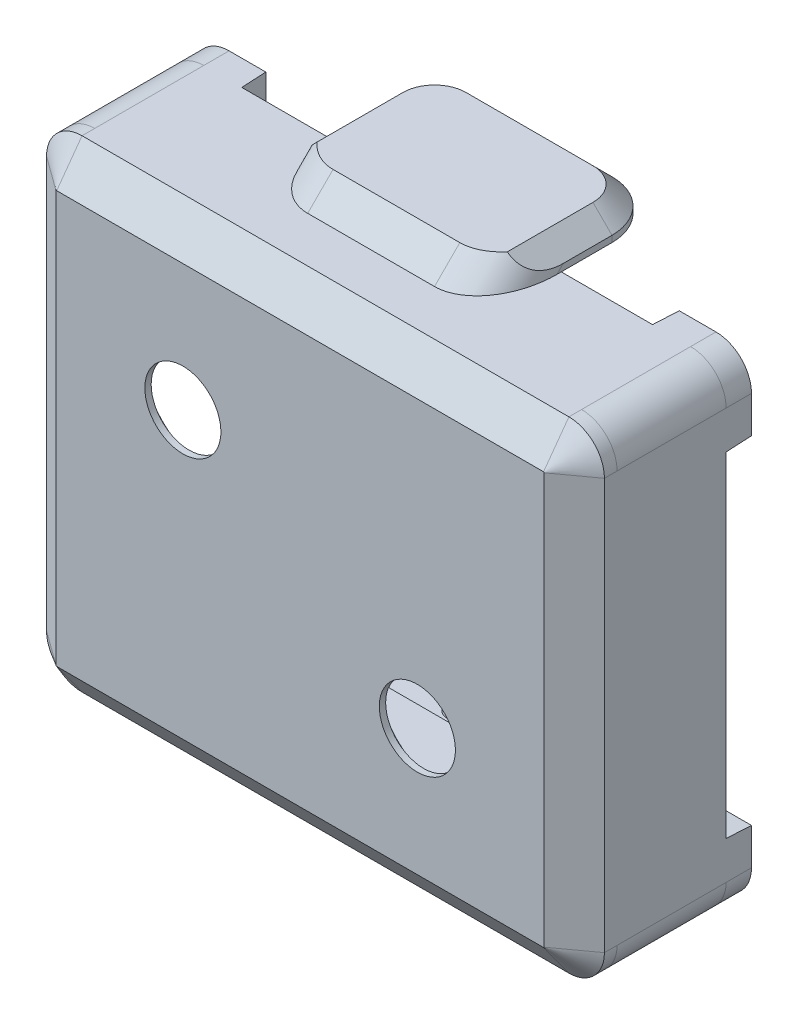
from build123d import *
from OCP.BRepAlgoAPI import BRepAlgoAPI_Cut
from OCP.TopTools import TopTools_ListOfShape
from OCP.BRepFilletAPI import BRepFilletAPI_MakeChamfer
from build123d.topology import SkipClean

# Parameters (mm, degrees)
WALLS_START            = -0.5
WALLS_DEPTH            = 4.299197948
BOTTOM_START           = 3.799199
BOTTOM_DEPTH           = 1.5
TABS_START             = 1
TABS_DEPTH             = 1
DRAFT_TABS_ANGLE       = 3
USB_HOLE_DEPTH         = 1.4
DRAFT1_ANGLE           = 3
DESQUISH_CHAMFER_SIZE  = 1
DESQUISH_CHAMFER_SIZE2 = 1.37638192
SUPPORTS_DEPTH         = 3.799198
SKETCH7_W              = 9
SKETCH7_H              = 7
BOSS_EXTRUDE1_DEPTH    = 1
BOSS_EXTRUDE2_START    = -19
SKETCH7_3_W            = 9
SKETCH7_3_H            = 7
BOSS_EXTRUDE2_DEPTH    = 1
BOSS_EXTRUDE3_DEPTH    = 0.5
BOSS_EXTRUDE4_START    = -18.5
BOSS_EXTRUDE4_DEPTH    = 0.5
FILLET2_R              = 2
FILLET1_R              = 0.5
CHAMFER1_SIZE          = 0.75
CHAMFER2_SIZE          = 1
FILLET3_R              = 2
SKETCH10_R             = 1.5
CUT_EXTRUDE1_DEPTH     = 1.5
CHAMFER3_SIZE          = 1.75
CHAMFER3_SIZE2         = 1.25


with BuildPart() as part:
    # walls: read off the stored shape, not the designer's step
    # walls outline → walls (new body)
    with BuildSketch(Plane.XY.offset(WALLS_START)):
        with BuildLine():
            ThreePointArc((20.5, 16.099999812), (20.089949494, 17.089949306), (19.1, 17.499999812))
            Line((19.1, 17.499999812), (-0.1, 17.499999812))
            ThreePointArc((-0.1, 17.499999812), (-1.089949494, 17.089949306), (-1.5, 16.099999812))
            Line((-1.5, 16.099999812), (-1.5, -0.100000188))
            ThreePointArc((-1.5, -0.100000188), (-1.089949494, -1.089949682), (-0.1, -1.500000188))
            Line((-0.1, -1.500000188), (19.1, -1.500000188))
            ThreePointArc((19.1, -1.500000188), (20.089949494, -1.089949682), (20.5, -0.100000188))
            Line((20.5, -0.100000188), (20.5, 16.099999812))
        make_face()
        Polygon((19.1, -0.100000019), (-0.1, -0.100000019), (-0.1, 16.1), (19.1, 16.099999981), align=None, mode=Mode.SUBTRACT)
    extrude(amount=WALLS_DEPTH)


with BuildPart() as bottom_tool:
    # Sketch1<6> → bottom (new body)
    with BuildSketch(Plane.XY.offset(BOTTOM_START)):
        with BuildLine():
            Line((-0.1, 17.5), (19.1, 17.5))
            ThreePointArc((19.1, 17.5), (20.089949494, 17.089949494), (20.5, 16.1))
            Line((20.5, 16.1), (20.5, -0.1))
            ThreePointArc((20.5, -0.1), (20.089949494, -1.089949494), (19.1, -1.5))
            Line((19.1, -1.5), (-0.1, -1.5))
            ThreePointArc((-0.1, -1.5), (-1.089949494, -1.089949494), (-1.5, -0.1))
            Line((-1.5, -0.1), (-1.5, 16.1))
            ThreePointArc((-1.5, 16.1), (-1.089949494, 17.089949494), (-0.1, 17.5))
        make_face()
    extrude(amount=BOTTOM_DEPTH)


with BuildPart() as part_1:
    add(part.part)


with BuildPart() as part_2:
    # bottom: joined with bottom_tool
    add(part_1.part.fuse(bottom_tool.part, tol=0.00001))

    # Sketch5 → tabs (add)
    with SkipClean():  # the faces are left unmerged after this step: merging them gives an invalid solid
        with BuildSketch(Plane(origin=(0, 0, -0.5), x_dir=(-1, 0, 0), z_dir=(0, 0, -1)).offset(TABS_START)):
            with BuildLine():
                ThreePointArc((-20.5, -0.1), (-20.089949494, -1.089949494), (-19.1, -1.5))
                Line((-19.1, -1.5), (-17.6, -1.5))
                Line((-17.6, -1.5), (-17.6, -0.1))
                Line((-17.6, -0.1), (-19.1, -0.1))
                Line((-19.1, -0.1), (-19.1, 1.4))
                Line((-19.1, 1.4), (-20.5, 1.4))
                Line((-20.5, 1.4), (-20.5, -0.1))
            make_face()
            with BuildLine():
                Line((0.1, -0.1), (-1.4, -0.1))
                Line((-1.4, -0.1), (-1.4, -1.5))
                Line((-1.4, -1.5), (0.1, -1.5))
                ThreePointArc((0.1, -1.5), (1.089949494, -1.089949494), (1.5, -0.1))
                Line((1.5, -0.1), (1.5, 1.4))
                Line((1.5, 1.4), (0.1, 1.4))
                Line((0.1, 1.4), (0.1, -0.1))
            make_face()
            with BuildLine():
                Line((-20.5, 14.6), (-19.1, 14.6))
                Line((-19.1, 14.6), (-19.1, 16.1))
                Line((-19.1, 16.1), (-17.6, 16.1))
                Line((-17.6, 16.1), (-17.6, 17.5))
                Line((-17.6, 17.5), (-19.1, 17.5))
                ThreePointArc((-19.1, 17.5), (-20.089949494, 17.089949494), (-20.5, 16.1))
                Line((-20.5, 16.1), (-20.5, 14.6))
            make_face()
            with BuildLine():
                Line((0.1, 16.1), (0.1, 14.6))
                Line((0.1, 14.6), (1.5, 14.6))
                Line((1.5, 14.6), (1.5, 16.1))
                ThreePointArc((1.5, 16.1), (1.089949494, 17.089949494), (0.1, 17.5))
                Line((0.1, 17.5), (-1.4, 17.5))
                Line((-1.4, 17.5), (-1.4, 16.1))
                Line((-1.4, 16.1), (0.1, 16.1))
            make_face()
        extrude(amount=-TABS_DEPTH)

    # draft tabs
    draft_tabs_faces = [part_2.faces().sort_by_distance(p)[0] for p in [
        (1.4, 16.8, -1),
        (19.8, 1.4, -1),
        (19.8, 14.6, -1),
        (1.4, -0.8, -1),
        (17.6, -0.8, -1),
        (17.6, 16.8, -1),
        (-0.8, 1.4, -1),
        (-0.8, 14.6, -1),
    ]]
    draft(draft_tabs_faces, Plane(origin=(0, 0, -0.5), x_dir=(-1, 0, 0), z_dir=(0, 0, -1)), DRAFT_TABS_ANGLE)

    # Sketch6 → usb hole (cut)
    with SkipClean():  # the faces are left unmerged after this step: merging them gives an invalid solid
        with BuildSketch(Plane.ZY.offset(1.5)):
            with BuildLine():
                Line((1.153553391, 1.43343172), (1.9, 1.43343172))
                ThreePointArc((1.9, 1.43343172), (2.359619408, 1.623812312), (2.55, 2.08343172))
                Line((2.55, 2.08343172), (2.55, 8.48343172))
                ThreePointArc((2.55, 8.48343172), (2.359619408, 8.943051128), (1.9, 9.13343172))
                Line((1.9, 9.13343172), (1.153553391, 9.13343172))
                ThreePointArc((1.153553391, 9.13343172), (0.90480916, 9.083953416), (0.693933983, 8.943051128))
                Line((0.693933983, 8.943051128), (0.090380592, 8.339497737))
                ThreePointArc((0.090380592, 8.339497737), (-0.050521696, 8.12862256), (-0.1, 7.879878329))
                Line((-0.1, 7.879878329), (-0.1, 5.29343172))
                Line((-0.1, 5.29343172), (-0.1, 5.27343172))
                Line((-0.1, 5.27343172), (-0.1, 2.686985111))
                ThreePointArc((-0.1, 2.686985111), (-0.050521696, 2.43824088), (0.090380592, 2.227365703))
                Line((0.090380592, 2.227365703), (0.693933983, 1.623812312))
                ThreePointArc((0.693933983, 1.623812312), (0.90480916, 1.482910024), (1.153553391, 1.43343172))
            make_face()
            with BuildLine():
                Line((-0.5, 2.227365703), (0.090380592, 2.227365703))
                ThreePointArc((0.090380592, 2.227365703), (-0.050521696, 2.43824088), (-0.1, 2.686985111))
                Line((-0.1, 2.686985111), (-0.1, 5.27343172))
                Line((-0.1, 5.27343172), (-0.1, 5.29343172))
                Line((-0.1, 5.29343172), (-0.1, 7.879878329))
                ThreePointArc((-0.1, 7.879878329), (-0.050521696, 8.12862256), (0.090380592, 8.339497737))
                Line((0.090380592, 8.339497737), (-0.5, 8.339497737))
                Line((-0.5, 8.339497737), (-0.5, 2.227365703))
            make_face()
        extrude(amount=-USB_HOLE_DEPTH, mode=Mode.SUBTRACT)

    # Draft1
    draft1_faces = [part_2.faces().sort_by_distance(p)[0] for p in [
        (-0.8, 8.339497737, -0.204809704),
        (-0.8, 2.227365703, -0.204809704),
    ]]
    draft(draft1_faces, Plane(origin=(0, 0, 0.090380592), x_dir=(0, -1, 0), z_dir=(0, 0, -1)), DRAFT1_ANGLE)

    # desquish chamfer: one chamfer whose edges measure the first distance from different faces: ONE call of the kernel's chamfer builder (chamfer() names one face for all edges)
    desquish_chamfer_edges_1 = [part_2.edges().sort_by_distance(p)[0] for p in [
        (-1.5, 8, 5.299199),
    ]]
    desquish_chamfer_side_1 = [part_2.faces().sort_by_distance(p)[0] for p in [
        (-1.5, 8.817703762, 2.795318179),
    ]]
    desquish_chamfer_edges_2 = [part_2.edges().sort_by_distance(p)[0] for p in [
        (9.5, -1.5, 5.299199),
    ]]
    desquish_chamfer_side_2 = [part_2.faces().sort_by_distance(p)[0] for p in [
        (9.5, -1.5, 4.549199),
    ]]
    desquish_chamfer_edges_3 = [part_2.edges().sort_by_distance(p)[0] for p in [
        (20.089949494, 17.089949494, 5.299199),
    ]]
    desquish_chamfer_side_3 = [part_2.faces().sort_by_distance(p)[0] for p in [
        (20.089949494, 17.089949494, 4.549199),
    ]]
    desquish_chamfer_edges_4 = [part_2.edges().sort_by_distance(p)[0] for p in [
        (9.5, 17.5, 5.299199),
    ]]
    desquish_chamfer_side_4 = [part_2.faces().sort_by_distance(p)[0] for p in [
        (9.5, 17.5, 4.549199),
    ]]
    desquish_chamfer_edges_5 = [part_2.edges().sort_by_distance(p)[0] for p in [
        (-1.089949494, 17.089949494, 5.299199),
    ]]
    desquish_chamfer_side_5 = [part_2.faces().sort_by_distance(p)[0] for p in [
        (-1.089949494, 17.089949494, 4.549199),
    ]]
    desquish_chamfer_edges_6 = [part_2.edges().sort_by_distance(p)[0] for p in [
        (-1.089949494, -1.089949494, 5.299199),
    ]]
    desquish_chamfer_side_6 = [part_2.faces().sort_by_distance(p)[0] for p in [
        (-1.089949494, -1.089949494, 4.549199),
    ]]
    desquish_chamfer_edges_7 = [part_2.edges().sort_by_distance(p)[0] for p in [
        (20.089949494, -1.089949494, 5.299199),
    ]]
    desquish_chamfer_side_7 = [part_2.faces().sort_by_distance(p)[0] for p in [
        (20.089949494, -1.089949494, 4.549199),
    ]]
    desquish_chamfer_edges_8 = [part_2.edges().sort_by_distance(p)[0] for p in [
        (20.5, 8, 5.299199),
    ]]
    desquish_chamfer_side_8 = [part_2.faces().sort_by_distance(p)[0] for p in [
        (20.5, 7.999999861, 2.399599246),
    ]]
    desquish_chamfer = BRepFilletAPI_MakeChamfer(part_2.part.solid().wrapped)
    for e in desquish_chamfer_edges_1:
        desquish_chamfer.Add(DESQUISH_CHAMFER_SIZE, DESQUISH_CHAMFER_SIZE2, e.wrapped, desquish_chamfer_side_1[0].wrapped)  # the first distance lies on this face
    for e in desquish_chamfer_edges_2:
        desquish_chamfer.Add(DESQUISH_CHAMFER_SIZE, DESQUISH_CHAMFER_SIZE2, e.wrapped, desquish_chamfer_side_2[0].wrapped)  # the first distance lies on this face
    for e in desquish_chamfer_edges_3:
        desquish_chamfer.Add(DESQUISH_CHAMFER_SIZE, DESQUISH_CHAMFER_SIZE2, e.wrapped, desquish_chamfer_side_3[0].wrapped)  # the first distance lies on this face
    for e in desquish_chamfer_edges_4:
        desquish_chamfer.Add(DESQUISH_CHAMFER_SIZE, DESQUISH_CHAMFER_SIZE2, e.wrapped, desquish_chamfer_side_4[0].wrapped)  # the first distance lies on this face
    for e in desquish_chamfer_edges_5:
        desquish_chamfer.Add(DESQUISH_CHAMFER_SIZE, DESQUISH_CHAMFER_SIZE2, e.wrapped, desquish_chamfer_side_5[0].wrapped)  # the first distance lies on this face
    for e in desquish_chamfer_edges_6:
        desquish_chamfer.Add(DESQUISH_CHAMFER_SIZE, DESQUISH_CHAMFER_SIZE2, e.wrapped, desquish_chamfer_side_6[0].wrapped)  # the first distance lies on this face
    for e in desquish_chamfer_edges_7:
        desquish_chamfer.Add(DESQUISH_CHAMFER_SIZE, DESQUISH_CHAMFER_SIZE2, e.wrapped, desquish_chamfer_side_7[0].wrapped)  # the first distance lies on this face
    for e in desquish_chamfer_edges_8:
        desquish_chamfer.Add(DESQUISH_CHAMFER_SIZE, DESQUISH_CHAMFER_SIZE2, e.wrapped, desquish_chamfer_side_8[0].wrapped)  # the first distance lies on this face
    add(Compound.cast(desquish_chamfer.Shape()), mode=Mode.REPLACE)

    # Sketch4 → supports (add)
    with SkipClean():  # the faces are left unmerged after this step: merging them gives an invalid solid
        with BuildSketch(Plane(origin=(0, -1.66e-07, 3.799197981), x_dir=(-1, 0, 0), z_dir=(-4.178627238637218e-15, 4.3711409000000035e-08, -0.9999999999999991))):
            Polygon((-19.1, 16.099999934), (-19.1, 14.652407714), (-17.652407779, 16.099999934), align=None)
            Polygon((0.1, 16.099999934), (-1.347592221, 16.099999934), (0.1, 14.652407714), align=None)
            Polygon((-19.1, 1.347592155), (-19.1, -0.100000066), (-17.652407779, -0.100000066), align=None)
            Polygon((0.1, 1.433431803), (-1.347592221, -0.100000066), (0.1, -0.100000066), (0.1, 1.347592155), align=None)
        extrude(amount=SUPPORTS_DEPTH)

    # Sketch7 → Boss-Extrude1 (add)
    with SkipClean():  # the faces are left unmerged after this step: merging them gives an invalid solid
        with BuildSketch(Plane(origin=(0, 17.499999978, 7.65e-07), x_dir=(1, 0, 0), z_dir=(0, 0.999999999999999, 4.371140900000003e-08))):
            with Locations((9.5, 1.000000765)):
                Rectangle(SKETCH7_W, SKETCH7_H)
        extrude(amount=BOSS_EXTRUDE1_DEPTH)

    # Sketch7<3> → Boss-Extrude2 (add)
    with SkipClean():  # the faces are left unmerged after this step: merging them gives an invalid solid
        with BuildSketch(Plane(origin=(0, 17.499999978, 7.65e-07), x_dir=(1, 0, 0), z_dir=(0, 0.999999999999999, 4.371140900000003e-08)).offset(BOSS_EXTRUDE2_START)):
            with Locations((9.5, 1.000000765)):
                Rectangle(SKETCH7_3_W, SKETCH7_3_H)
        extrude(amount=-BOSS_EXTRUDE2_DEPTH)

    # Sketch7<4> → Boss-Extrude3 (add)
    with SkipClean():  # the faces are left unmerged after this step: merging them gives an invalid solid
        with BuildSketch(Plane(origin=(0, 17.499999978, 7.65e-07), x_dir=(1, 0, 0), z_dir=(0, 0.999999999999999, 4.371140900000003e-08))):
            with BuildLine():
                Line((8, 3.000000765), (11, 3.000000765))
                ThreePointArc((11, 3.000000765), (11.5, 2.500000765), (11, 2.000000765))
                Line((11, 2.000000765), (8, 2.000000765))
                ThreePointArc((8, 2.000000765), (7.5, 2.500000765), (8, 3.000000765))
            make_face()
        extrude(amount=-BOSS_EXTRUDE3_DEPTH)

    # Sketch7<5> → Boss-Extrude4 (add)
    with SkipClean():  # the faces are left unmerged after this step: merging them gives an invalid solid
        with BuildSketch(Plane(origin=(0, 17.499999978, 7.65e-07), x_dir=(1, 0, 0), z_dir=(0, 0.999999999999999, 4.371140900000003e-08)).offset(BOSS_EXTRUDE4_START)):
            with BuildLine():
                Line((8, 3.000000765), (11, 3.000000765))
                ThreePointArc((11, 3.000000765), (11.5, 2.500000765), (11, 2.000000765))
                Line((11, 2.000000765), (8, 2.000000765))
                ThreePointArc((8, 2.000000765), (7.5, 2.500000765), (8, 3.000000765))
            make_face()
        extrude(amount=-BOSS_EXTRUDE4_DEPTH)

    # Fillet2
    fillet2_edges = [part_2.edges().sort_by_distance(p)[0] for p in [
        (5, 18.000000175, -4.499999978),
        (14, 18.000000175, -4.499999978),
        (5, -1.999999825, -4.500000852),
        (14, -1.999999825, -4.500000852),
    ]]
    fillet(fillet2_edges, radius=FILLET2_R)

    # Fillet1
    fillet1_edges = [part_2.edges().sort_by_distance(p)[0] for p in [
        (9.5, 17.000000109, -3.000000022),
        (11.5, 17.000000087, -2.500000022),
        (9.5, 17.000000066, -2.000000022),
        (9.5, -0.999999891, -3.000000809),
        (11.5, -0.999999913, -2.500000809),
        (9.5, -0.999999934, -2.000000809),
        (7.5, 17.000000087, -2.500000022),
        (7.5, -0.999999913, -2.500000809),
    ]]
    fillet(fillet1_edges, radius=FILLET1_R - 0.0001)  # a hair under: the kernel refuses the full size

    # Chamfer1
    chamfer1_edges = [part_2.edges().sort_by_distance(p)[0] for p in [
        (5, 18.499999978, 4.4e-08),
        (14, 18.499999978, 4.4e-08),
        (14, -2.500000022, -8.74e-07),
        (5, -2.500000022, -8.74e-07),
        (9.5, -2.499999825, -4.500000874),
        (13.414213562, -2.499999851, -3.914214437),
        (5.585786438, -2.499999851, -3.914214437),
        (9.5, 18.500000175, -4.499999956),
        (5.585786438, 18.500000149, -3.914213519),
        (13.414213562, 18.500000149, -3.914213519),
    ]]
    chamfer(chamfer1_edges, length=CHAMFER1_SIZE)

    # Chamfer2
    chamfer2_edges = [part_2.edges().sort_by_distance(p)[0] for p in [
        (9.5, -2.500000131, 2.499999126),
        (9.5, 18.499999869, 2.500000044),
    ]]
    chamfer(chamfer2_edges, length=CHAMFER2_SIZE - 0.0001)  # a hair under: the kernel refuses the full size

    # Fillet3
    # the kernel refuses this fillet: 2 mm, written as the material it takes off along each edge
    with BuildSketch(Plane(origin=(5, 2.03543362, 6.03553323), x_dir=(0, 0.7071068120951806, -0.707106750277913), z_dir=(0, -0.707106750277913, -0.7071068120951807))) as fillet3_piece_1_section:
        with BuildLine():
            CenterArc((FILLET3_R, FILLET3_R), FILLET3_R, 180, 90)
            Line((0, FILLET3_R), (0, 0))
            Line((0, 0), (FILLET3_R, 0))
        make_face()
    fillet3_piece_1 = extrude(amount=10.353411969, mode=Mode.PRIVATE)
    fillet3_piece_1 = split(fillet3_piece_1, bisect_by=Plane(origin=(5, -1.500000188, 6.03553323), z_dir=(0, -1, 0)), keep=Keep.TOP, mode=Mode.PRIVATE)
    with BuildSketch(Plane(origin=(14, 2.03543362, 6.03553323), x_dir=(-1, 0, 0), z_dir=(0, -0.707106750277913, -0.7071068120951807))) as fillet3_piece_2_section:
        with BuildLine():
            CenterArc((FILLET3_R, FILLET3_R), FILLET3_R, 180, 90)
            Line((0, FILLET3_R), (0, 0))
            Line((0, 0), (FILLET3_R, 0))
        make_face()
    fillet3_piece_2 = extrude(amount=10.353411969, mode=Mode.PRIVATE)
    fillet3_piece_2 = split(fillet3_piece_2, bisect_by=Plane(origin=(14, -1.500000188, 6.03553323), z_dir=(0, -1, 0)), keep=Keep.TOP, mode=Mode.PRIVATE)
    with BuildSketch(Plane(origin=(14, 13.964565808, 6.035533751), x_dir=(0, -0.7071067502779134, -0.7071068120951804), z_dir=(0, 0.7071068120951804, -0.7071067502779134))) as fillet3_piece_3_section:
        with BuildLine():
            CenterArc((FILLET3_R, FILLET3_R), FILLET3_R, 180, 90)
            Line((0, FILLET3_R), (0, 0))
            Line((0, 0), (FILLET3_R, 0))
        make_face()
    fillet3_piece_3 = extrude(amount=10.353411969, mode=Mode.PRIVATE)
    fillet3_piece_3 = split(fillet3_piece_3, bisect_by=Plane(origin=(14, 17.499999812, 6.035533751), z_dir=(0, 1, 0)), keep=Keep.TOP, mode=Mode.PRIVATE)
    with BuildSketch(Plane(origin=(5, 13.964565808, 6.035533751), x_dir=(0, -0.7071067502779134, -0.7071068120951804), z_dir=(0, 0.7071068120951804, -0.7071067502779134))) as fillet3_piece_4_section:
        with BuildLine():
            CenterArc((FILLET3_R, -FILLET3_R), FILLET3_R, 90, 90)
            Line((0, -FILLET3_R), (0, 0))
            Line((0, 0), (FILLET3_R, 0))
        make_face()
    fillet3_piece_4 = extrude(amount=10.353411969, mode=Mode.PRIVATE)
    fillet3_piece_4 = split(fillet3_piece_4, bisect_by=Plane(origin=(5, 17.499999812, 6.035533751), z_dir=(0, 1, 0)), keep=Keep.TOP, mode=Mode.PRIVATE)
    add([fillet3_piece_1, fillet3_piece_2, fillet3_piece_3, fillet3_piece_4], mode=Mode.SUBTRACT)


with BuildPart() as cut_extrude1_tool:
    # Sketch10 → Cut-Extrude1 (new body)
    with BuildSketch(Plane(origin=(0, -2.32e-07, 5.299197981), x_dir=(1, 0, 0), z_dir=(4.178627238637218e-15, -4.3711409000000035e-08, 0.9999999999999991))):
        with Locations(Location((4.876381667, 11.123618311, 0), (0, 0, 270))):
            Circle(SKETCH10_R)
        with Locations(Location((14.123618333, 4.876381853, 0), (0, 0, 270))):
            Circle(SKETCH10_R)
    extrude(amount=-CUT_EXTRUDE1_DEPTH)


with BuildPart() as part_3:
    add(part_2.part)

    # Cut-Extrude1: cut by cut_extrude1_tool, with a tolerance
    cut_extrude1_stock = TopTools_ListOfShape()
    cut_extrude1_stock.Append(part_3.part.wrapped)
    cut_extrude1_tools = TopTools_ListOfShape()
    cut_extrude1_tools.Append(cut_extrude1_tool.part.wrapped)
    cut_extrude1_cut = BRepAlgoAPI_Cut()
    cut_extrude1_cut.SetArguments(cut_extrude1_stock)
    cut_extrude1_cut.SetTools(cut_extrude1_tools)
    cut_extrude1_cut.SetFuzzyValue(0.00001)
    cut_extrude1_cut.Build()
    add(Compound.cast(cut_extrude1_cut.Shape()).solids(), mode=Mode.REPLACE)

    # Chamfer3
    chamfer3_edges = [part_3.edges().sort_by_distance(p)[0] for p in [
        (4.876381667, 12.623618145, 3.799198533),
        (14.123618333, 6.376381687, 3.799198259),
    ]]
    chamfer3_side = [part_3.faces().sort_by_distance(p)[0] for p in [
        (9.501935664, 8.001508451, 3.799199),
    ]]
    chamfer(chamfer3_edges, length=CHAMFER3_SIZE, length2=CHAMFER3_SIZE2, reference=chamfer3_side[0])


solid = part_3.part
